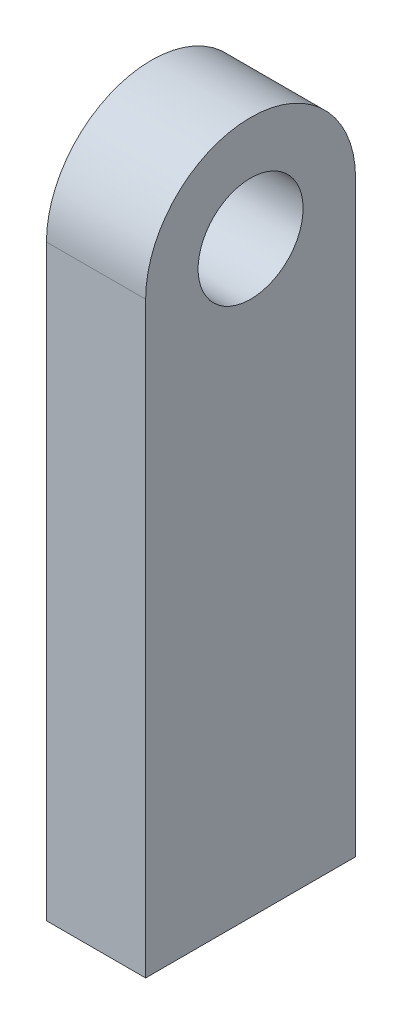
from build123d import *

# Parameters (mm, degrees)
SKETCH3_R           = 3.175
BOSS_EXTRUDE2_DEPTH = 5.999999938


with BuildPart() as part:
    # Sketch3 → Boss-Extrude2 (new body)
    with BuildSketch(Plane(origin=(0, 0, 0), x_dir=(0, 0, -1), z_dir=(1, 0, 0))):
        with BuildLine():
            ThreePointArc((6.35, 0), (0, 6.35), (-6.35, 0))
            Line((-6.35, 0), (-6.35, -35.56))
            Line((-6.35, -35.56), (6.35, -35.56))
            Line((6.35, -35.56), (6.35, 0))
        make_face()
        Circle(SKETCH3_R, mode=Mode.SUBTRACT)
    extrude(amount=BOSS_EXTRUDE2_DEPTH)


solid = part.part
